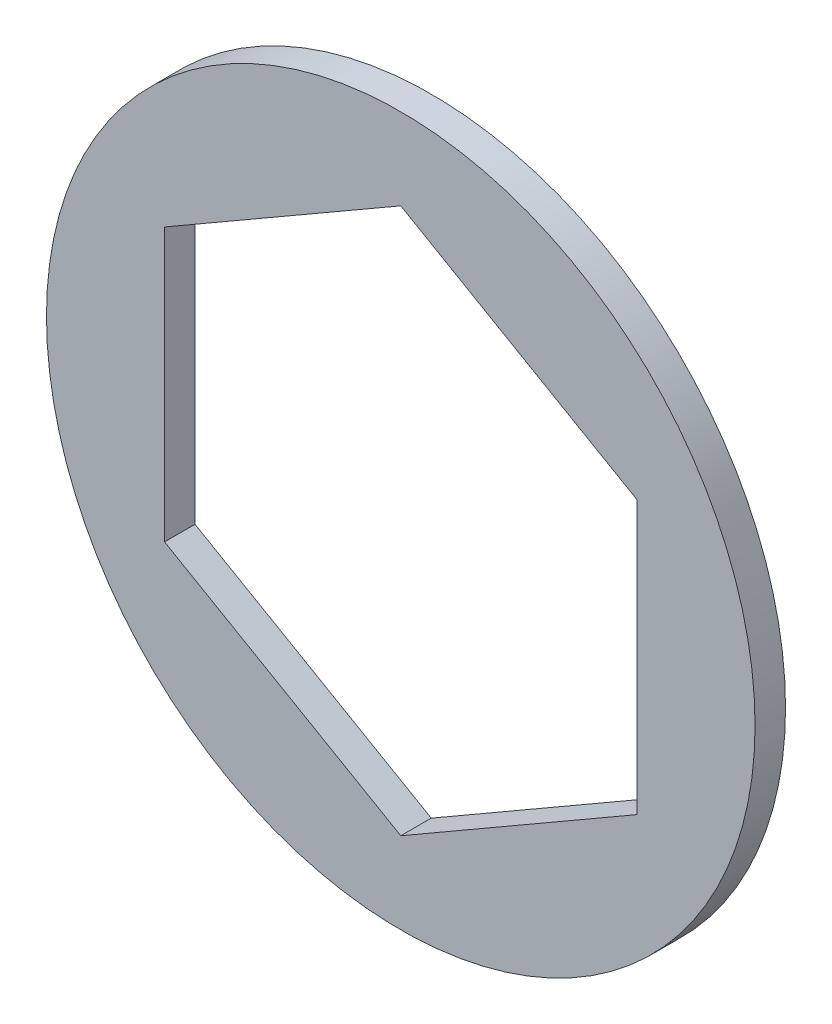
from build123d import *

# Parameters (mm, degrees)
SKETCH1_R           = 9.525
BOSS_EXTRUDE1_DEPTH = 0.409575


with BuildPart() as part:
    # Sketch1 → Boss-Extrude1 (new, symmetric)
    with BuildSketch(Plane.XY):
        Circle(SKETCH1_R)
        Polygon((0, 7.332348419), (-6.35, 3.666174209), (-6.35, -3.666174209), (0, -7.332348419), (6.35, -3.666174209), (6.35, 3.666174209), align=None, mode=Mode.SUBTRACT)
    extrude(amount=BOSS_EXTRUDE1_DEPTH, both=True)


solid = part.part
